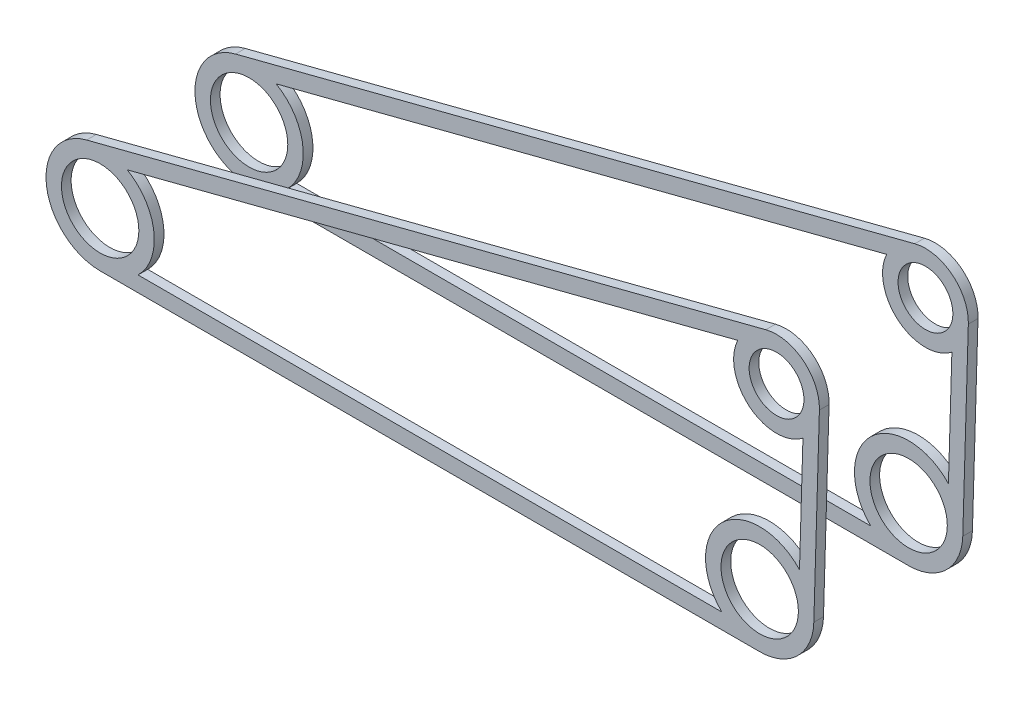
from build123d import *

# Parameters (mm, degrees)
BOSS_EXTRUDE1_START = 11.43
SKETCH1_R           = 6.35
SKETCH1_R_2         = 4.5
BOSS_EXTRUDE1_DEPTH = 1.5875
BOSS_EXTRUDE2_START = -11.43
SKETCH1_4_R         = 6.35
SKETCH1_4_R_2       = 4.5
BOSS_EXTRUDE2_DEPTH = 1.5875


with BuildPart() as part:
    # Sketch1 → Boss-Extrude1 (new body)
    with BuildSketch(Plane.XY.offset(BOSS_EXTRUDE1_START)):
        with BuildLine():
            ThreePointArc((-2.221699529, 8.607912128), (-8.819196075, -1.119768097), (0, -8.89))
            Line((0, -8.89), (108.26242, -8.89))
            ThreePointArc((108.26242, -8.89), (114.454150638, -6.379229711), (117.148465455, -0.265134243))
            Line((117.148465455, -0.265134243), (118.062120191, 30.356249907))
            ThreePointArc((118.062120191, 30.356249907), (115.41913329, 36.066701365), (109.265885693, 37.382824312))
            Line((109.265885693, 37.382824312), (-2.221699529, 8.607912128))
        make_face()
        Circle(SKETCH1_R, mode=Mode.SUBTRACT)
        with BuildLine():
            Line((4.437355326, 7.703374436), (104.658429941, 33.570403624))
            ThreePointArc((104.658429941, 33.570403624), (106.631370308, 25.065718601), (115.361783043, 25.02039203))
            Line((115.361783043, 25.02039203), (114.795150642, 6.02955474))
            ThreePointArc((114.795150642, 6.02955474), (102.070689362, 6.379229711), (102.040716053, -6.35))
            Line((102.040716053, -6.35), (6.221703947, -6.35))
            ThreePointArc((6.221703947, -6.35), (8.819196075, 1.119768097), (4.437355326, 7.703374436))
        make_face(mode=Mode.SUBTRACT)
        with Locations((111.025251799, 30.566209983)):
            Circle(SKETCH1_R_2, mode=Mode.SUBTRACT)
        with Locations((108.26242, 0)):
            Circle(SKETCH1_R, mode=Mode.SUBTRACT)
    extrude(amount=BOSS_EXTRUDE1_DEPTH)


with BuildPart() as body_2:
    # Sketch1<4> → Boss-Extrude2 (new body)
    with BuildSketch(Plane.XY.offset(BOSS_EXTRUDE2_START)):
        with BuildLine():
            ThreePointArc((-2.221699529, 8.607912128), (-8.819196075, -1.119768097), (0, -8.89))
            Line((0, -8.89), (108.26242, -8.89))
            ThreePointArc((108.26242, -8.89), (114.454150638, -6.379229711), (117.148465455, -0.265134243))
            Line((117.148465455, -0.265134243), (118.062120191, 30.356249907))
            ThreePointArc((118.062120191, 30.356249907), (115.41913329, 36.066701365), (109.265885693, 37.382824312))
            Line((109.265885693, 37.382824312), (-2.221699529, 8.607912128))
        make_face()
        Circle(SKETCH1_4_R, mode=Mode.SUBTRACT)
        with BuildLine():
            Line((4.437355326, 7.703374436), (104.658429941, 33.570403624))
            ThreePointArc((104.658429941, 33.570403624), (106.631370308, 25.065718601), (115.361783043, 25.02039203))
            Line((115.361783043, 25.02039203), (114.795150642, 6.02955474))
            ThreePointArc((114.795150642, 6.02955474), (102.070689362, 6.379229711), (102.040716053, -6.35))
            Line((102.040716053, -6.35), (6.221703947, -6.35))
            ThreePointArc((6.221703947, -6.35), (8.819196075, 1.119768097), (4.437355326, 7.703374436))
        make_face(mode=Mode.SUBTRACT)
        with Locations((111.025251799, 30.566209983)):
            Circle(SKETCH1_4_R_2, mode=Mode.SUBTRACT)
        with Locations((108.26242, 0)):
            Circle(SKETCH1_4_R, mode=Mode.SUBTRACT)
    extrude(amount=-BOSS_EXTRUDE2_DEPTH)


solid = Compound([part.part, body_2.part])
